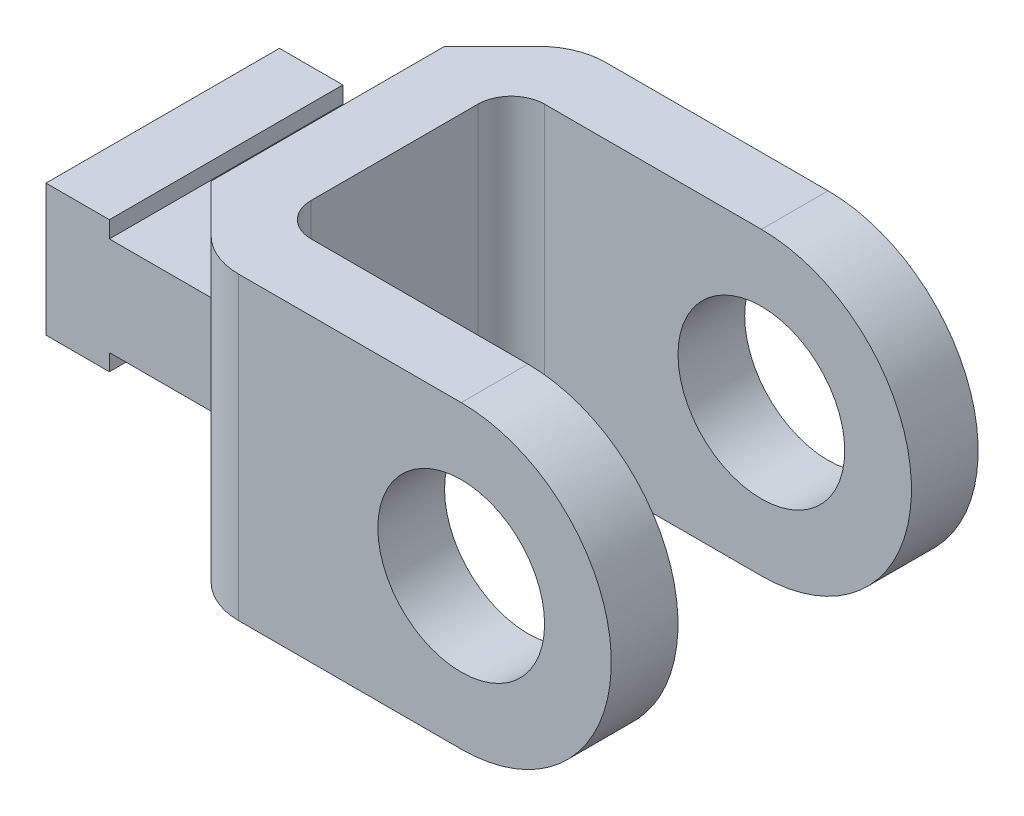
from build123d import *

# Parameters (mm, degrees)
BOSS_EXTRUDE2_DEPTH  = 7
SKETCH2_R            = 2.5
BOSS_EXTRUDE3_DEPTH  = 2
CUT_EXTRUDE3_DEPTH   = 18.291616466
FILLET1_R            = 1
FILLET2_R            = 2
FILLET2_OF_MIRROR2_R = 2
FILLET3_R            = 1


with BuildPart() as part:
    # Sketch1 → Boss-Extrude2 (new body)
    with BuildSketch(Plane.XY):
        Polygon((-4.05, 1.475), (-4.05, 1.975), (-5.95, 1.975), (-5.95, -1.975), (-4.05, -1.975), (-4.05, -1.475), (-1, -1.475), (-1, -4.5), (1, -4.5), (1, 4.5), (-1, 4.5), (-1, 1.475), align=None)
    boss_extrude2 = extrude(amount=BOSS_EXTRUDE2_DEPTH)

    # Sketch2 → Boss-Extrude3 (add)
    with BuildSketch(Plane.XY):
        with BuildLine():
            Line((-1, 4.5), (8.5, 4.5))
            ThreePointArc((8.5, 4.5), (13, 0), (8.5, -4.5))
            Line((8.5, -4.5), (-1, -4.5))
            Line((-1, -4.5), (-1, 4.5))
        make_face()
        with Locations((8.5, 0)):
            Circle(SKETCH2_R, mode=Mode.SUBTRACT)
    boss_extrude3 = extrude(amount=-BOSS_EXTRUDE3_DEPTH)

    # Sketch4 → Cut-Extrude3 (cut, through all)
    with BuildSketch(Plane(origin=(0, 4.5, 0), x_dir=(1, 0, 0), z_dir=(0, 1, 0))):
        Polygon((-1, 0), (1, 2), (-1, 2), align=None)
    cut_extrude3 = extrude(amount=-CUT_EXTRUDE3_DEPTH, mode=Mode.SUBTRACT)

    # Fillet1
    fillet1_edges = [part.edges().sort_by_distance(p)[0] for p in [
        (1, 0, 0),
    ]]
    fillet(fillet1_edges, radius=FILLET1_R)

    # Fillet2
    fillet2_edges = [part.edges().sort_by_distance(p)[0] for p in [
        (1, 0, -2),
    ]]
    fillet(fillet2_edges, radius=FILLET2_R)

    # Mirror2: Boss-Extrude2, Boss-Extrude3, Cut-Extrude3 across plane
    add(boss_extrude2.mirror(Plane.XY.offset(3.5)))
    add(boss_extrude3.mirror(Plane.XY.offset(3.5)))
    add(cut_extrude3.mirror(Plane.XY.offset(3.5)), mode=Mode.SUBTRACT)

    # Fillet2 of Mirror2
    fillet2_of_mirror2_edges = [part.edges().sort_by_distance(p)[0] for p in [
        (1, 0, 9),
    ]]
    fillet(fillet2_of_mirror2_edges, radius=FILLET2_OF_MIRROR2_R)

    # Fillet3
    fillet3_edges = [part.edges().sort_by_distance(p)[0] for p in [
        (1, 0, 7),
    ]]
    fillet(fillet3_edges, radius=FILLET3_R)


solid = part.part
